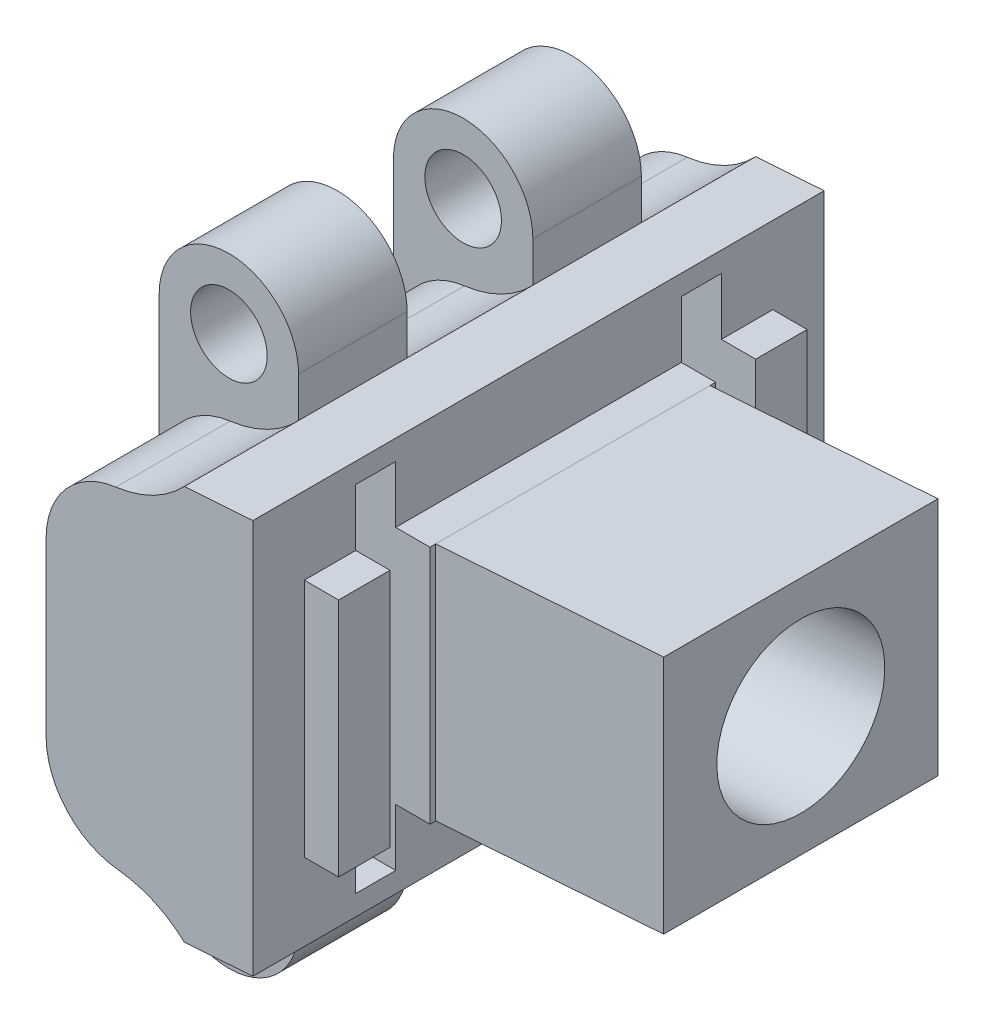
from build123d import *

# Parameters (mm, degrees)
SKETCH4_W               = 13
SKETCH4_H               = 29
BOSS_EXTRUDE1_DEPTH     = 50
SKETCH6_R               = 3.35
BOSS_EXTRUDE2_DEPTH     = 4.75
MIRROR2_COPY_1_SKETCH_R = 3.35
MIRROR2_COPY_1_DEPTH    = 4.75
FILLET2_R               = 7
SKETCH7_W               = 50
SKETCH7_H               = 34.11
BOSS_EXTRUDE3_DEPTH     = 6
BOSS_EXTRUDE4_REACH     = 60.145
CUT_EXTRUDE1_DEPTH      = 59.144819202
SKETCH10_W              = 41
SKETCH10_H              = 21
BOSS_EXTRUDE5_DEPTH     = 3
FILLET4_R               = 10
CUT_EXTRUDE2_DEPTH      = 60.713063897
CUT_EXTRUDE2_DEPTH_BACK = 7
SKETCH11_W              = 3.5
SKETCH11_H              = 31
SKETCH12_W              = 24
SKETCH12_H              = 21
BOSS_EXTRUDE7_DEPTH     = 20
SKETCH15_R              = 7.35
CUT_EXTRUDE3_DEPTH      = 24


with BuildPart() as part:
    # Sketch4 → Boss-Extrude1 (new body)
    with BuildSketch(Plane.XY):
        with Locations((0.5, 0)):
            Rectangle(SKETCH4_W, SKETCH4_H)
    extrude(amount=BOSS_EXTRUDE1_DEPTH)

    # Sketch6 → Boss-Extrude2 (add, symmetric)
    with BuildSketch(Plane.XY.offset(14.75)):
        with BuildLine():
            Line((6.1, 1), (6.1, 21))
            ThreePointArc((6.1, 21), (0, 27.1), (-6.1, 21))
            Line((-6.1, 21), (-6.1, 1))
            Line((-6.1, 1), (6.1, 1))
        make_face()
        with Locations((0, 21)):
            Circle(SKETCH6_R, mode=Mode.SUBTRACT)
    boss_extrude2 = extrude(amount=BOSS_EXTRUDE2_DEPTH, both=True)

    # Mirror1: Boss-Extrude2 across plane
    add(boss_extrude2.mirror(Plane.XY.offset(25)))

    # Mirror2: Boss-Extrude2 across plane
    add(boss_extrude2.mirror(Plane.ZX))

    # Mirror2 copy 1 sketch → Mirror2 copy 1 (add, symmetric)
    with BuildSketch(Plane(origin=(0, 0, 35.25), x_dir=(1, 0, 0), z_dir=(0, 0, -1))):
        with BuildLine():
            Line((6.1, 1), (6.1, 21))
            ThreePointArc((6.1, 21), (0, 27.1), (-6.1, 21))
            Line((-6.1, 21), (-6.1, 1))
            Line((-6.1, 1), (6.1, 1))
        make_face()
        with Locations((0, 21)):
            Circle(MIRROR2_COPY_1_SKETCH_R, mode=Mode.SUBTRACT)
    extrude(amount=MIRROR2_COPY_1_DEPTH, both=True)

    # Fillet2
    fillet2_edges = [part.edges().sort_by_distance(p)[0] for p in [
        (-6, 14.5, 5),
        (-6, 14.5, 25),
        (-6, -14.5, 5),
        (-6, -14.5, 25),
        (-6, 14.5, 45),
        (-6, -14.5, 45),
    ]]
    fillet(fillet2_edges, radius=FILLET2_R)

    # Sketch7 → Boss-Extrude3 (add)
    with BuildSketch(Plane(origin=(6.1, 0, 0), x_dir=(0, 0, -1), z_dir=(1, 0, 0))):
        with Locations((-25, 0)):
            Rectangle(SKETCH7_W, SKETCH7_H)
    extrude(amount=BOSS_EXTRUDE3_DEPTH)

    # Boss-Extrude4: up to this face of the body (flat: up to its plane)
    boss_extrude4_end = Plane(part.part.faces().sort_by_distance((3.691573852, 0, 0))[0])
    # Sketch8 → Boss-Extrude4 (add, up to the picked face)
    with BuildSketch(Plane.XY.offset(50), mode=Mode.PRIVATE) as boss_extrude4_sk1:
        Polygon((6.1, 17.481553553), (12.1, 17.901114425), (12.1, 17.055), (6.1, 17.055), align=None)
    boss_extrude4_tool1 = split(extrude(boss_extrude4_sk1.sketch, amount=-BOSS_EXTRUDE4_REACH, mode=Mode.PRIVATE), bisect_by=boss_extrude4_end, keep=Keep.BOTH, mode=Mode.PRIVATE)
    add(boss_extrude4_tool1.solids().sort_by(Axis((9.42967, 17.384693, 50), (0, 0, -1)))[0])

    # Sketch9 → Cut-Extrude1 (cut, through all)
    with BuildSketch(Plane.XY.offset(50)):
        Polygon((6.1, -17.055), (17.728439632, -16.241860289), (17.728439632, -20.144237666), (6.1, -20.144237666), align=None)
    extrude(amount=-CUT_EXTRUDE1_DEPTH, mode=Mode.SUBTRACT)

    # Sketch10 → Boss-Extrude5 (add)
    with BuildSketch(Plane(origin=(12.1, 0, 0), x_dir=(0, 0, -1), z_dir=(1, 0, 0))):
        with Locations((-25, 0.632837648)):
            Rectangle(SKETCH10_W, SKETCH10_H)
    extrude(amount=BOSS_EXTRUDE5_DEPTH)

    # Fillet4
    # the kernel refuses this fillet: 10 mm, written as the material it adds along each edge
    with BuildSketch(Plane(origin=(6.1, -14.5, 50), x_dir=(0, -1, 0), z_dir=(0, 0, -1))) as fillet4_piece_1:
        with BuildLine():
            CenterArc((9.918128411, 6.76641264), FILLET4_R, 185.625410645, 36.956323183)
            Line((-0.033711831, 5.78616991), (-1.028895855, 5.688145638))
            ThreePointArc((-1.028895855, 5.688145638), (-1, 5.1), (-1, 0))
            Line((-1, 0), (0, -1))
            ThreePointArc((0, -1), (1.2775, -1), (1.818687159, -0.676641264))
            Line((1.818687159, -0.676641264), (2.555, 0))
        make_face()
    extrude(amount=24.465670292)
    with BuildSketch(Plane(origin=(6.1, -14.5, 44.965670292), x_dir=(0, -1, 0), z_dir=(0, 0, -1))) as fillet4_piece_2:
        with BuildLine():
            CenterArc((9.918128411, 6.76641264), FILLET4_R, 185.625410645, 36.956323183)
            Line((-0.033711831, 5.78616991), (-1.028895855, 5.688145638))
            ThreePointArc((-1.028895855, 5.688145638), (-1, 5.1), (-1, 0))
            Line((-1, 0), (0, -1))
            ThreePointArc((0, -1), (1.2775, -1), (1.818687159, -0.676641264))
            Line((1.818687159, -0.676641264), (2.555, 0))
        make_face()
    extrude(amount=39.931340584)
    with BuildSketch(Plane(origin=(6.1, -14.5, 24.465670292), x_dir=(-0.9999830276779416, 0.005826178512287368, 0), z_dir=(0, 0, -1))) as fillet4_piece_3:
        with BuildLine():
            CenterArc((6.708513011, -9.957382405), FILLET4_R, 95.291593317, 36.956323183)
            Line((-0.014885886, -2.554956636), (-0.687225776, -1.814714059))
            ThreePointArc((-0.687225776, -1.814714059), (-1.007425971, -1.271652139), (-0.999983028, 0.005826179))
            Line((-0.999983028, 0.005826179), (0.005826179, 0.999983028))
            ThreePointArc((0.005826179, 0.999983028), (5.10573962, 0.970269517), (5.694043627, 0.99573824))
            Line((5.694043627, 0.99573824), (5.786268117, 0))
        make_face()
    extrude(amount=24.465670292)
    with BuildSketch(Plane(origin=(6.1, 14.5, 0), x_dir=(-0.9999554494088081, -0.009439237131707428, 0), z_dir=(0, 0, 1))) as fillet4_piece_4:
        with BuildLine():
            CenterArc((7.162570226, -9.930782909), FILLET4_R, 96.745204553, 39.23266057)
            Line((-0.028143591, -2.981420723), (-0.747214973, -2.286484504))
            ThreePointArc((-0.747214973, -2.286484504), (-1.014027245, -1.481271124), (-0.999955449, 0.009439237))
            Line((-0.999955449, 0.009439237), (0.009439237, 0.999955449))
            ThreePointArc((0.009439237, 0.999955449), (5.109212029, 0.95181534), (5.870573137, 0.993078291))
            Line((5.870573137, 0.993078291), (5.988027418, 0))
        make_face()
    extrude(amount=24.970068545)
    with BuildSketch(Plane(origin=(6.1, 14.5, 4.529931455), x_dir=(0, 1, 0), z_dir=(0, 0, 1))) as fillet4_piece_5:
        with BuildLine():
            CenterArc((9.862731288, 7.255990144), FILLET4_R, 187.286041034, 39.23266057)
            Line((-0.056522411, 5.987760648), (-1.048447781, 5.860937698))
            ThreePointArc((-1.048447781, 5.860937698), (-1, 5.1), (-1, 0))
            Line((-1, 0), (0, -1))
            ThreePointArc((0, -1), (1.490776776, -1), (2.293435779, -0.725599014))
            Line((2.293435779, -0.725599014), (2.981553553, 0))
        make_face()
    extrude(amount=40.940137089)
    with BuildSketch(Plane(origin=(6.1, 14.5, 25.029931455), x_dir=(0, 1, 0), z_dir=(0, 0, 1))) as fillet4_piece_6:
        with BuildLine():
            CenterArc((9.862731288, 7.255990144), FILLET4_R, 187.286041034, 39.23266057)
            Line((-0.056522411, 5.987760648), (-1.048447781, 5.860937698))
            ThreePointArc((-1.048447781, 5.860937698), (-1, 5.1), (-1, 0))
            Line((-1, 0), (0, -1))
            ThreePointArc((0, -1), (1.490776776, -1), (2.293435779, -0.725599014))
            Line((2.293435779, -0.725599014), (2.981553553, 0))
        make_face()
    extrude(amount=24.970068545)

    # Sketch11 → Cut-Extrude2 (cut, two sides: drawn at the far end of the back side and taken through both)
    with BuildSketch(Plane(origin=(12.1, 0, 0), x_dir=(0, 0, -1), z_dir=(1, 0, 0)).offset(-CUT_EXTRUDE2_DEPTH_BACK)):
        with Locations((-10.75, 0.632837648)):
            Rectangle(SKETCH11_W, SKETCH11_H)
        with Locations((-39.25, 0.632837648)):
            Rectangle(SKETCH11_W, SKETCH11_H)
    extrude(amount=CUT_EXTRUDE2_DEPTH + CUT_EXTRUDE2_DEPTH_BACK, mode=Mode.SUBTRACT)

    # Sketch12 → Boss-Extrude7 (add, along a direction that is not the sketch's normal)
    with BuildSketch(Plane(origin=(15.1, 0, 0), x_dir=(0, 0, -1), z_dir=(1, 0, 0))):
        with Locations((-25, 0.632837648)):
            Rectangle(SKETCH12_W, SKETCH12_H)
    extrude(amount=BOSS_EXTRUDE7_DEPTH, dir=(0.9975640502598245, 0.069756473744122, 0))

    # Sketch15 → Cut-Extrude3 (cut)
    with BuildSketch(Plane(origin=(35.752500693, 2.500058392, 0), x_dir=(0, 0, -1), z_dir=(0.9975640502598246, 0.06975647374412185, 0))):
        with Locations(Location((-25, -0.396449194, 0), (0, 0, 90))):
            Circle(SKETCH15_R)
    extrude(amount=-CUT_EXTRUDE3_DEPTH, mode=Mode.SUBTRACT)


solid = part.part
